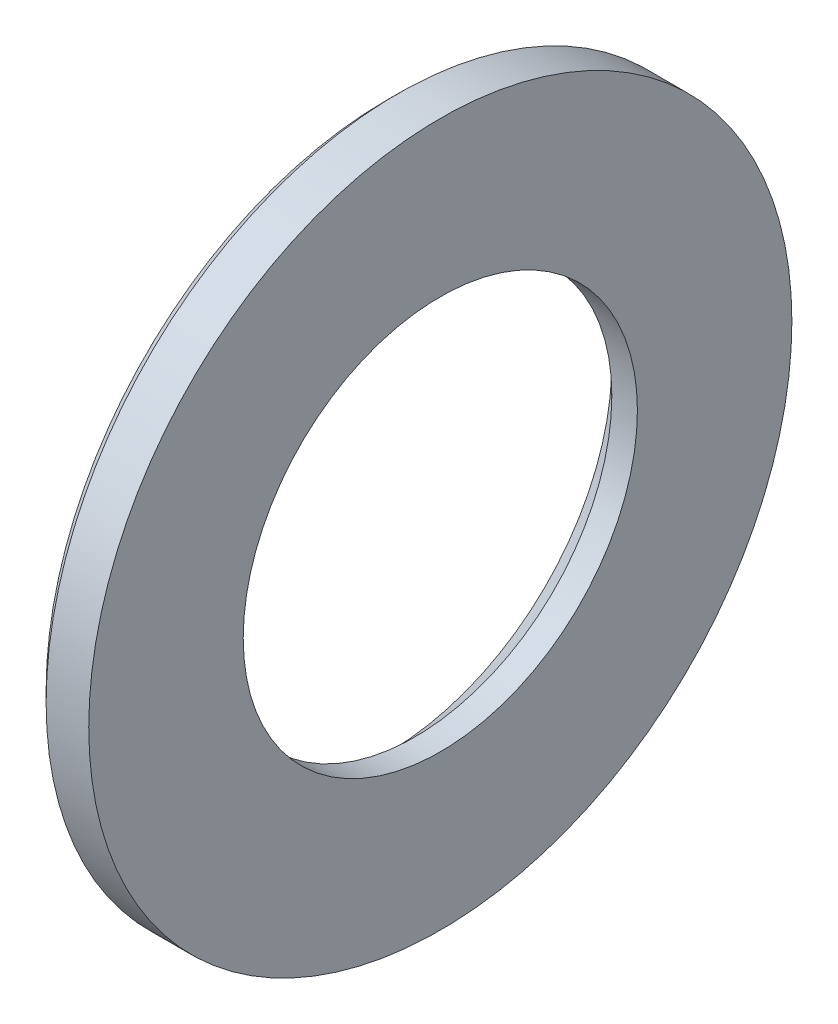
from build123d import *


with BuildPart() as part:
    # Sketch1 → Base-Revolve (revolve)
    with BuildSketch(Plane.XY):
        Polygon((0, 18.5), (0, 33), (-4, 33), (-5, 32), (-5, 21.1), (-2.4, 18.5), align=None)
    revolve(axis=Axis((-34.925, 0, 0), (1, 0, 0)))


solid = part.part
